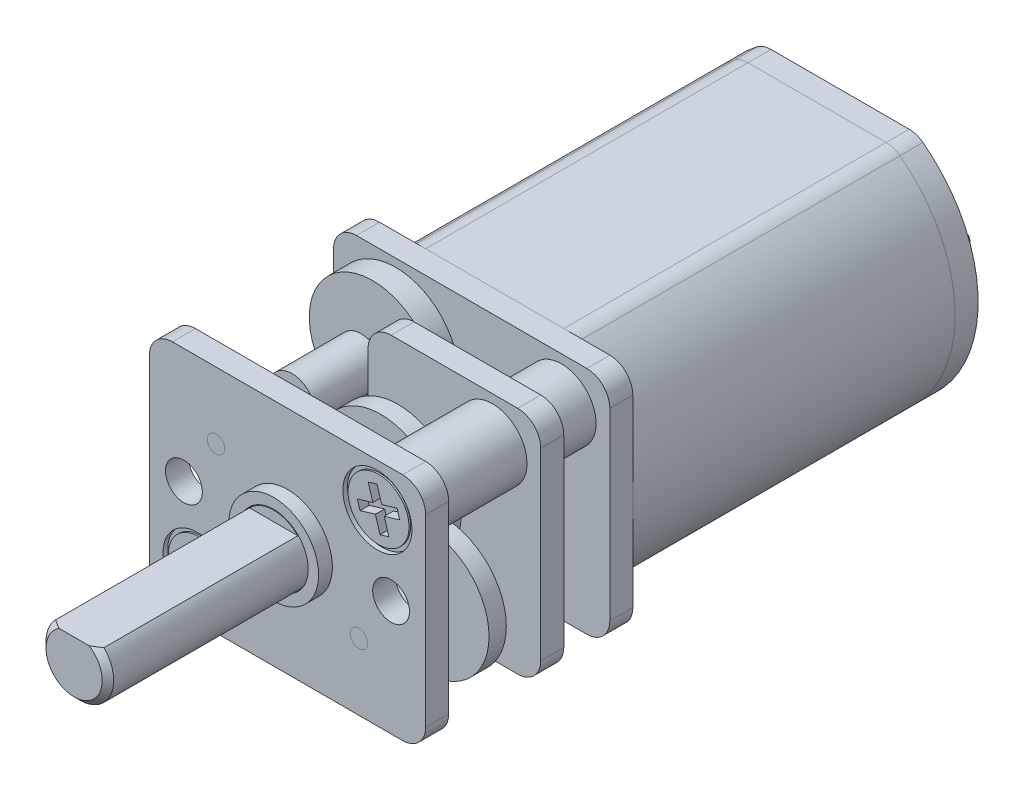
from build123d import *

# Parameters (mm, degrees)
BOSS_EXTRUDE1_DEPTH    = 7.5
FILLET3_R              = 1
BOSS_EXTRUDE2_DEPTH    = 1
BOSS_EXTRUDE3_START    = 9
BOSS_EXTRUDE3_DEPTH    = 1
SKETCH7_R              = 0.5
BOSS_EXTRUDE5_DEPTH    = 8
BOSS_EXTRUDE5_2_DEPTH  = 8
BOSS_EXTRUDE8_START    = 2
BOSS_EXTRUDE8_DEPTH    = 1
CUT_EXTRUDE1_START     = -9
SKETCH5_R              = 0.75
SKETCH5_R_2            = 0.38
CUT_EXTRUDE1_DEPTH     = 9
SKETCH8_R              = 0.5
SKETCH8_R_2            = 0.38
CUT_EXTRUDE2_DEPTH     = 1
BOSS_EXTRUDE6_START    = 0.2
SKETCH9_R              = 2.75
SKETCH9_R_2            = 0.5
BOSS_EXTRUDE6_DEPTH    = 1
BOSS_EXTRUDE16_START   = 0.1
SKETCH9_3_R            = 1
SKETCH9_3_R_2          = 0.75
BOSS_EXTRUDE16_DEPTH   = 1.3
SKETCH6_R              = 1.95
SKETCH6_R_2            = 0.75
BOSS_EXTRUDE4_DEPTH    = 0.6
BOSS_EXTRUDE7_START    = 0.5
SKETCH10_R             = 1
SKETCH10_R_2           = 0.5
BOSS_EXTRUDE7_DEPTH    = 3
SKETCH12_R             = 1.5
SKETCH12_R_2           = 0.75
BOSS_EXTRUDE9_DEPTH    = 2
BOSS_EXTRUDE9_2_DEPTH  = 2
BOSS_EXTRUDE10_START   = 3
SKETCH12_2_R           = 1.5
SKETCH12_2_R_2         = 0.75
BOSS_EXTRUDE10_DEPTH   = 4
BOSS_EXTRUDE10_2_DEPTH = 4
SKETCH13_R             = 1.5
CUT_EXTRUDE3_DEPTH     = 7.2
SKETCH14_R             = 1.5
CUT_EXTRUDE4_DEPTH     = 0.2
CHAMFER1_SIZE          = 0.5
BOSS_EXTRUDE11_START   = 0.2
SKETCH15_R             = 2.75
BOSS_EXTRUDE11_DEPTH   = 0.75
BOSS_EXTRUDE12_START   = 0.2
SKETCH16_R             = 1
BOSS_EXTRUDE12_DEPTH   = 1.15
BOSS_EXTRUDE13_START   = 0.4
SKETCH17_R             = 2.75
BOSS_EXTRUDE13_DEPTH   = 0.75
BOSS_EXTRUDE14_START   = 0.2
SKETCH18_R             = 1
BOSS_EXTRUDE14_DEPTH   = 1.5
SKETCH19_R             = 0.5
CUT_EXTRUDE5_DEPTH     = 25.100622399
SKETCH20_R             = 2.75
BOSS_EXTRUDE15_DEPTH   = 1
CUT_EXTRUDE6_START     = -22.8
SKETCH21_R             = 0.5
CUT_EXTRUDE6_DEPTH     = 24.6
CHAMFER2_SIZE          = 0.25
CUT_EXTRUDE7_DEPTH     = 8.67
SKETCH24_R             = 0.8
CUT_EXTRUDE8_DEPTH     = 1
CUT_EXTRUDE9_START     = -1
CUT_EXTRUDE9_DEPTH     = 1
BOSS_EXTRUDE17_DEPTH   = 1
SKETCH27_R             = 2.5
BOSS_EXTRUDE18_DEPTH   = 1.5
SKETCH28_W             = 0.3
SKETCH28_H             = 1.5
BOSS_EXTRUDE19_DEPTH   = 2
BOSS_EXTRUDE19_2_DEPTH = 2
FILLET1_R              = 0.7
FILLET2_R              = 0.7
CUT_EXTRUDE10_START    = 16.05
CUT_EXTRUDE10_2_DEPTH  = 0.4
CUT_EXTRUDE10_4_DEPTH  = 0.4


with BuildPart() as part:
    # Sketch1 → Boss-Extrude1 (new, symmetric)
    with BuildSketch(Plane.XY):
        with BuildLine():
            Line((3.31662479, 5), (-3.31662479, 5))
            ThreePointArc((-3.31662479, 5), (-6, 0), (-3.31662479, -5))
            Line((-3.31662479, -5), (3.31662479, -5))
            ThreePointArc((3.31662479, -5), (6, 0), (3.31662479, 5))
        make_face()
    extrude(amount=BOSS_EXTRUDE1_DEPTH, both=True)

    # Fillet3
    fillet3_edges = [part.edges().sort_by_distance(p)[0] for p in [
        (3.31662479, -5, 0),
        (-3.31662479, -5, 0),
        (-3.31662479, 5, 0),
        (3.31662479, 5, 0),
    ]]
    fillet(fillet3_edges, radius=FILLET3_R)

    # Sketch25 → Cut-Extrude9 (cut)
    with BuildSketch(Plane(origin=(0, 0, -7.5), x_dir=(-1, 0, 0), z_dir=(0, 0, -1)).offset(CUT_EXTRUDE9_START)):
        with BuildLine():
            Line((-3, -5), (3, -5))
            ThreePointArc((3, -5), (3.316227766, -4.948683298), (3.6, -4.8))
            ThreePointArc((3.6, -4.8), (6, 0), (3.6, 4.8))
            ThreePointArc((3.6, 4.8), (3.316227766, 4.948683298), (3, 5))
            Line((3, 5), (-3, 5))
            ThreePointArc((-3, 5), (-3.316227766, 4.948683298), (-3.6, 4.8))
            ThreePointArc((-3.6, 4.8), (-6, 0), (-3.6, -4.8))
            ThreePointArc((-3.6, -4.8), (-3.316227766, -4.948683298), (-3, -5))
        make_face()
    extrude(amount=CUT_EXTRUDE9_DEPTH, mode=Mode.SUBTRACT)


with BuildPart() as body_2:
    # Sketch2 → Boss-Extrude2 (new body)
    with BuildSketch(Plane.XY.offset(7.5)):
        with BuildLine():
            Line((-5, -5), (5, -5))
            ThreePointArc((5, -5), (5.707106781, -4.707106781), (6, -4))
            Line((6, -4), (6, 4))
            ThreePointArc((6, 4), (5.707106781, 4.707106781), (5, 5))
            Line((5, 5), (-5, 5))
            ThreePointArc((-5, 5), (-5.707106781, 4.707106781), (-6, 4))
            Line((-6, 4), (-6, -4))
            ThreePointArc((-6, -4), (-5.707106781, -4.707106781), (-5, -5))
        make_face()
    extrude(amount=BOSS_EXTRUDE2_DEPTH)


with BuildPart() as body_3:
    # Sketch2<2> → Boss-Extrude3 (new body)
    with BuildSketch(Plane.XY.offset(7.5).offset(BOSS_EXTRUDE3_START)):
        with BuildLine():
            Line((-5, -5), (5, -5))
            ThreePointArc((5, -5), (5.707106781, -4.707106781), (6, -4))
            Line((6, -4), (6, 4))
            ThreePointArc((6, 4), (5.707106781, 4.707106781), (5, 5))
            Line((5, 5), (-5, 5))
            ThreePointArc((-5, 5), (-5.707106781, 4.707106781), (-6, 4))
            Line((-6, 4), (-6, -4))
            ThreePointArc((-6, -4), (-5.707106781, -4.707106781), (-5, -5))
        make_face()
    extrude(amount=-BOSS_EXTRUDE3_DEPTH)


with BuildPart() as body_4:
    # Sketch7 → Boss-Extrude5 (new body)
    with BuildSketch(Plane.XY.offset(8.5)):
        with Locations(Location((-3.104083332, 2.104083332, 0), (0, 0, 180))):
            Circle(SKETCH7_R)
    extrude(amount=BOSS_EXTRUDE5_DEPTH)


with BuildPart() as body_5:
    # Sketch7 → Boss-Extrude5 2 (new body)
    with BuildSketch(Plane.XY.offset(8.5)):
        with Locations(Location((3.104083332, -2.104083332, 0), (0, 0, 180))):
            Circle(SKETCH7_R)
    extrude(amount=BOSS_EXTRUDE5_2_DEPTH)


with BuildPart() as body_6:
    # Sketch11 → Boss-Extrude8 (new body)
    with BuildSketch(Plane.XY.offset(8.5).offset(BOSS_EXTRUDE8_START)):
        with BuildLine():
            Line((-5, -1.25), (-2.5, -1.25))
            ThreePointArc((-2.5, -1.25), (-1.792893219, -0.957106781), (-1.5, -0.25))
            Line((-1.5, -0.25), (-1.5, 4))
            ThreePointArc((-1.5, 4), (-1.207106781, 4.707106781), (-0.5, 5))
            Line((-0.5, 5), (5, 5))
            ThreePointArc((5, 5), (5.707106781, 4.707106781), (6, 4))
            Line((6, 4), (6, -4))
            ThreePointArc((6, -4), (5.707106781, -4.707106781), (5, -5))
            Line((5, -5), (-5, -5))
            ThreePointArc((-5, -5), (-5.707106781, -4.707106781), (-6, -4))
            Line((-6, -4), (-6, -2.25))
            ThreePointArc((-6, -2.25), (-5.707106781, -1.542893219), (-5, -1.25))
        make_face()
    extrude(amount=BOSS_EXTRUDE8_DEPTH)


with BuildPart() as cut_extrude1_tool:
    # Sketch5 → Cut-Extrude1 (new body)
    with BuildSketch(Plane.XY.offset(16.5).offset(CUT_EXTRUDE1_START)):
        Circle(SKETCH5_R)
        with Locations((-3.104083332, 2.104083332)):
            Circle(SKETCH5_R_2)
        with Locations((3.104083332, -2.104083332)):
            Circle(SKETCH5_R_2)
        with Locations((3.904344047, 3.123475238)):
            Circle(SKETCH5_R)
        with Locations((-3.904344047, -3.123475238)):
            Circle(SKETCH5_R)
    extrude(amount=CUT_EXTRUDE1_DEPTH)


with BuildPart() as body_2_1:
    add(body_2.part)

    # Cut-Extrude1: cut by cut_extrude1_tool
    add(cut_extrude1_tool.part, mode=Mode.SUBTRACT)


with BuildPart() as body_3_1:
    add(body_3.part)

    # Cut-Extrude1: cut by cut_extrude1_tool
    add(cut_extrude1_tool.part, mode=Mode.SUBTRACT)

    # Sketch6 → Boss-Extrude4 (add)
    with BuildSketch(Plane.XY.offset(16.5)):
        with Locations(Location((0, 0, 0), (0, 0, 180))):
            Circle(SKETCH6_R)
        Circle(SKETCH6_R_2, mode=Mode.SUBTRACT)
    extrude(amount=BOSS_EXTRUDE4_DEPTH)

    # Sketch13 → Cut-Extrude3 (cut)
    with BuildSketch(Plane.XY.offset(17.1)):
        Circle(SKETCH13_R)
    extrude(amount=-CUT_EXTRUDE3_DEPTH, mode=Mode.SUBTRACT)

    # Sketch14 → Cut-Extrude4 (cut)
    with BuildSketch(Plane.XY.offset(16.5)):
        with Locations(Location((3.904344047, 3.123475238, 0), (0, 0, 180))):
            Circle(SKETCH14_R)
        with Locations(Location((-3.904344047, -3.123475238, 0), (0, 0, 180))):
            Circle(SKETCH14_R)
    extrude(amount=-CUT_EXTRUDE4_DEPTH, mode=Mode.SUBTRACT)

    # Chamfer1
    chamfer1_edges = [body_3_1.edges().sort_by_distance(p)[0] for p in [
        (3.154344047, 3.123475238, 16.3),
        (-4.654344047, -3.123475238, 16.3),
    ]]
    chamfer(chamfer1_edges, length=CHAMFER1_SIZE)

    # Sketch24 → Cut-Extrude8 (cut)
    with BuildSketch(Plane.XY.offset(16.5)):
        with Locations((4.5, 0)):
            Circle(SKETCH24_R)
        with Locations((-4.5, 0)):
            Circle(SKETCH24_R)
    extrude(amount=-CUT_EXTRUDE8_DEPTH, mode=Mode.SUBTRACT)


with BuildPart() as body_6_1:
    add(body_6.part)

    # Cut-Extrude1: cut by cut_extrude1_tool
    add(cut_extrude1_tool.part, mode=Mode.SUBTRACT)


with BuildPart() as cut_extrude2_tool:
    # Sketch8 → Cut-Extrude2 (new body)
    # profile 1 of 2: a face of its own
    with BuildSketch(Plane.XY.offset(16.5)):
        with Locations((-3.104083332, 2.104083332)):
            Circle(SKETCH8_R)
        with Locations((-3.104083332, 2.104083332)):
            Circle(SKETCH8_R_2, mode=Mode.SUBTRACT)
    # profile 2 of 2: a face of its own
    with BuildSketch(Plane.XY.offset(16.5)):
        with Locations((3.104083332, -2.104083332)):
            Circle(SKETCH8_R)
        with Locations((3.104083332, -2.104083332)):
            Circle(SKETCH8_R_2, mode=Mode.SUBTRACT)
    extrude(amount=-CUT_EXTRUDE2_DEPTH)


with BuildPart() as body_4_1:
    add(body_4.part)

    # Cut-Extrude2: cut by cut_extrude2_tool
    add(cut_extrude2_tool.part, mode=Mode.SUBTRACT)


with BuildPart() as body_5_1:
    add(body_5.part)

    # Cut-Extrude2: cut by cut_extrude2_tool
    add(cut_extrude2_tool.part, mode=Mode.SUBTRACT)


with BuildPart() as body_7:
    # Sketch9 → Boss-Extrude6 (new body)
    with BuildSketch(Plane.XY.offset(8.5).offset(BOSS_EXTRUDE6_START)):
        with Locations((-3.104083332, 2.104083332)):
            Circle(SKETCH9_R)
        with Locations((-3.104083332, 2.104083332)):
            Circle(SKETCH9_R_2, mode=Mode.SUBTRACT)
    extrude(amount=BOSS_EXTRUDE6_DEPTH)


with BuildPart() as body_8:
    # Sketch9<3> → Boss-Extrude16 (new body)
    # profile 1 of 2: a face of its own
    with BuildSketch(Plane.XY.offset(8.5).offset(BOSS_EXTRUDE16_START)):
        Circle(SKETCH9_3_R)
        Circle(SKETCH9_3_R_2, mode=Mode.SUBTRACT)
    # profile 2 of 2: a face of its own
    with BuildSketch(Plane.XY.offset(8.5).offset(BOSS_EXTRUDE16_START)):
        Circle(SKETCH9_3_R_2)
    extrude(amount=BOSS_EXTRUDE16_DEPTH)


with BuildPart() as body_9:
    # Sketch10 → Boss-Extrude7 (new body)
    with BuildSketch(Plane.XY.offset(9.7).offset(BOSS_EXTRUDE7_START)):
        with Locations((-3.104083332, 2.104083332)):
            Circle(SKETCH10_R)
        with Locations((-3.104083332, 2.104083332)):
            Circle(SKETCH10_R_2, mode=Mode.SUBTRACT)
    extrude(amount=BOSS_EXTRUDE7_DEPTH)


with BuildPart() as body_10:
    # Sketch12 → Boss-Extrude9 (new body)
    with BuildSketch(Plane.XY.offset(8.5)):
        with Locations((-3.904344047, -3.123475238)):
            Circle(SKETCH12_R)
        with Locations((-3.904344047, -3.123475238)):
            Circle(SKETCH12_R_2, mode=Mode.SUBTRACT)
    extrude(amount=BOSS_EXTRUDE9_DEPTH)


with BuildPart() as body_11:
    # Sketch12 → Boss-Extrude9 2 (new body)
    with BuildSketch(Plane.XY.offset(8.5)):
        with Locations((3.904344047, 3.123475238)):
            Circle(SKETCH12_R)
        with Locations((3.904344047, 3.123475238)):
            Circle(SKETCH12_R_2, mode=Mode.SUBTRACT)
    extrude(amount=BOSS_EXTRUDE9_2_DEPTH)


with BuildPart() as body_12:
    # Sketch12<2> → Boss-Extrude10 (new body)
    with BuildSketch(Plane.XY.offset(8.5).offset(BOSS_EXTRUDE10_START)):
        with Locations(Location((-3.904344047, -3.123475238, 0), (0, 0, 180))):
            Circle(SKETCH12_2_R)
        with Locations(Location((-3.904344047, -3.123475238, 0), (0, 0, 180))):
            Circle(SKETCH12_2_R_2, mode=Mode.SUBTRACT)
    extrude(amount=BOSS_EXTRUDE10_DEPTH)


with BuildPart() as body_13:
    # Sketch12<2> → Boss-Extrude10 2 (new body)
    with BuildSketch(Plane.XY.offset(8.5).offset(BOSS_EXTRUDE10_START)):
        with Locations(Location((3.904344047, 3.123475238, 0), (0, 0, 180))):
            Circle(SKETCH12_2_R)
        with Locations(Location((3.904344047, 3.123475238, 0), (0, 0, 180))):
            Circle(SKETCH12_2_R_2, mode=Mode.SUBTRACT)
    extrude(amount=BOSS_EXTRUDE10_2_DEPTH)


with BuildPart() as body_14:
    # Sketch15 → Boss-Extrude11 (new body)
    with BuildSketch(Plane.XY.offset(11.5).offset(BOSS_EXTRUDE11_START)):
        Circle(SKETCH15_R)
    extrude(amount=BOSS_EXTRUDE11_DEPTH)


with BuildPart() as body_15:
    # Sketch16 → Boss-Extrude12 (new body)
    with BuildSketch(Plane.XY.offset(12.45).offset(BOSS_EXTRUDE12_START)):
        Circle(SKETCH16_R)
    extrude(amount=BOSS_EXTRUDE12_DEPTH)


with BuildPart() as body_16:
    # Sketch17 → Boss-Extrude13 (new body)
    with BuildSketch(Plane.XY.offset(12.45).offset(BOSS_EXTRUDE13_START)):
        with Locations((3.104083332, -2.104083332)):
            Circle(SKETCH17_R)
    extrude(amount=BOSS_EXTRUDE13_DEPTH)


with BuildPart() as body_17:
    # Sketch18 → Boss-Extrude14 (new body)
    with BuildSketch(Plane.XY.offset(13.6).offset(BOSS_EXTRUDE14_START)):
        with Locations((3.104083332, -2.104083332)):
            Circle(SKETCH18_R)
    extrude(amount=BOSS_EXTRUDE14_DEPTH)


with BuildPart() as cut_extrude5_tool:
    # Sketch19 → Cut-Extrude5 (new, through all)
    with BuildSketch(Plane.XY.offset(15.3)):
        with Locations((3.104083332, -2.104083332)):
            Circle(SKETCH19_R)
    extrude(amount=-CUT_EXTRUDE5_DEPTH)


with BuildPart() as body_17_1:
    add(body_17.part)

    # Cut-Extrude5: cut by cut_extrude5_tool
    add(cut_extrude5_tool.part, mode=Mode.SUBTRACT)


with BuildPart() as body_16_1:
    add(body_16.part)

    # Cut-Extrude5: cut by cut_extrude5_tool
    add(cut_extrude5_tool.part, mode=Mode.SUBTRACT)


with BuildPart() as body_6_2:
    add(body_6_1.part)

    # Cut-Extrude5: cut by cut_extrude5_tool
    add(cut_extrude5_tool.part, mode=Mode.SUBTRACT)


with BuildPart() as body_18:
    # Sketch20 → Boss-Extrude15 (new body)
    with BuildSketch(Plane.XY.offset(15.3)):
        Circle(SKETCH20_R)
    extrude(amount=-BOSS_EXTRUDE15_DEPTH)


with BuildPart() as cut_extrude6_tool:
    # Sketch21 → Cut-Extrude6 (new body)
    with BuildSketch(Plane.XY.offset(15.3).offset(CUT_EXTRUDE6_START)):
        Circle(SKETCH21_R)
    extrude(amount=CUT_EXTRUDE6_DEPTH)


with BuildPart() as body_14_1:
    add(body_14.part)

    # Cut-Extrude6: cut by cut_extrude6_tool
    add(cut_extrude6_tool.part, mode=Mode.SUBTRACT)


with BuildPart() as body_15_1:
    add(body_15.part)

    # Cut-Extrude6: cut by cut_extrude6_tool
    add(cut_extrude6_tool.part, mode=Mode.SUBTRACT)


with BuildPart() as body_18_1:
    add(body_18.part)

    # Cut-Extrude6: cut by cut_extrude6_tool
    add(cut_extrude6_tool.part, mode=Mode.SUBTRACT)


with BuildPart() as body_8_1:
    add(body_8.part)

    # Cut-Extrude6: cut by cut_extrude6_tool
    add(cut_extrude6_tool.part, mode=Mode.SUBTRACT)


with BuildPart() as body_19:
    # Sketch22 → Revolve1 (revolve)
    with BuildSketch(Plane(origin=(0, 0, 0), x_dir=(1, 0, 0), z_dir=(0, 1, 0))):
        Polygon((-0.5, -7.5), (-0.5, -15.3), (-1.47, -15.3), (-1.47, -25.77), (0, -25.77), (0, -7.5), align=None)
    revolve(axis=Axis((0, 0, 0), (0, 0, 1)))

    # Chamfer2
    chamfer2_edges = [body_19.edges().sort_by_distance(p)[0] for p in [
        (1.47, 0, 25.77),
    ]]
    chamfer(chamfer2_edges, length=CHAMFER2_SIZE)

    # Sketch23 → Cut-Extrude7 (cut)
    with BuildSketch(Plane.XY.offset(25.77)):
        with BuildLine():
            Line((1.048808848, 1.03), (-1.048808848, 1.03))
            ThreePointArc((-1.048808848, 1.03), (0, 1.47), (1.048808848, 1.03))
        make_face()
    extrude(amount=-CUT_EXTRUDE7_DEPTH, mode=Mode.SUBTRACT)


with BuildPart() as body_20:
    # Sketch26 → Boss-Extrude17 (new body)
    with BuildSketch(Plane(origin=(0, 0, -6.5), x_dir=(-1, 0, 0), z_dir=(0, 0, -1))):
        with BuildLine():
            Line((-3, -5), (3, -5))
            ThreePointArc((3, -5), (3.316227766, -4.948683298), (3.6, -4.8))
            ThreePointArc((3.6, -4.8), (6, 0), (3.6, 4.8))
            ThreePointArc((3.6, 4.8), (3.316227766, 4.948683298), (3, 5))
            Line((3, 5), (-3, 5))
            ThreePointArc((-3, 5), (-3.316227766, 4.948683298), (-3.6, 4.8))
            ThreePointArc((-3.6, 4.8), (-6, 0), (-3.6, -4.8))
            ThreePointArc((-3.6, -4.8), (-3.316227766, -4.948683298), (-3, -5))
        make_face()
    extrude(amount=BOSS_EXTRUDE17_DEPTH)

    # Sketch27 → Boss-Extrude18 (add)
    with BuildSketch(Plane(origin=(0, 0, -7.5), x_dir=(-1, 0, 0), z_dir=(0, 0, -1))):
        Circle(SKETCH27_R)
    extrude(amount=BOSS_EXTRUDE18_DEPTH)


with BuildPart() as body_21:
    # Sketch28 → Boss-Extrude19 (new body)
    with BuildSketch(Plane(origin=(0, 0, -7.5), x_dir=(-1, 0, 0), z_dir=(0, 0, -1))):
        with Locations((3.5, 0)):
            Rectangle(SKETCH28_W, SKETCH28_H)
    extrude(amount=BOSS_EXTRUDE19_DEPTH)

    # Fillet1
    fillet1_edges = [body_21.edges().sort_by_distance(p)[0] for p in [
        (-3.5, -0.75, -9.5),
        (-3.5, 0.75, -9.5),
    ]]
    fillet(fillet1_edges, radius=FILLET1_R)


with BuildPart() as body_22:
    # Sketch28 → Boss-Extrude19 2 (new body)
    with BuildSketch(Plane(origin=(0, 0, -7.5), x_dir=(-1, 0, 0), z_dir=(0, 0, -1))):
        with Locations((-3.5, 0)):
            Rectangle(SKETCH28_W, SKETCH28_H)
    extrude(amount=BOSS_EXTRUDE19_2_DEPTH)

    # Fillet2
    fillet2_edges = [body_22.edges().sort_by_distance(p)[0] for p in [
        (3.5, -0.75, -9.5),
        (3.5, 0.75, -9.5),
    ]]
    fillet(fillet2_edges, radius=FILLET2_R)


with BuildPart() as body_23:
    # Cut-Extrude10: read off the stored shape, not the designer's step
    # Cut-Extrude10 outline → Cut-Extrude10 (revolve)
    with BuildSketch(Plane(origin=(-3.904344047, -3.123475238, 0), x_dir=(1, 0, 0), z_dir=(0, -1, 0))):
        Polygon((0.921954446, 16.05), (0, 16.05), (0, 7.5), (0.7, 7.5), (0.7, 15.755), (1.325, 16.38), (1.325, 16.45), (0.921954446, 16.45), align=None)
    revolve(axis=Axis((-3.904344047, -3.123475238, 0), (0, 0, 1)))

    # Cut-Extrude10 2 outline → Cut-Extrude10 2 (add)
    with BuildSketch(Plane.XY.offset(CUT_EXTRUDE10_START)):
        with BuildLine():
            ThreePointArc((-2.991618301, -3.253597153), (-3.064453219, -2.743234002), (-3.399902702, -2.35176355))
            Line((-3.399902702, -2.35176355), (-3.646677303, -3.006822552))
            Line((-3.646677303, -3.006822552), (-2.991618301, -3.253597153))
        make_face()
        with BuildLine():
            Line((-3.774222132, -2.210749492), (-3.399902702, -2.35176355))
            ThreePointArc((-3.399902702, -2.35176355), (-3.579322703, -2.260711582), (-3.774222132, -2.210749492))
        make_face()
        with BuildLine():
            Line((-4.020996733, -2.865808494), (-3.774222132, -2.210749492))
            ThreePointArc((-3.774222132, -2.210749492), (-4.284585282, -2.28358441), (-4.676055735, -2.619033892))
            Line((-4.676055735, -2.619033892), (-4.020996733, -2.865808494))
        make_face()
        with BuildLine():
            Line((-4.817069793, -2.993353322), (-4.676055735, -2.619033892))
            ThreePointArc((-4.676055735, -2.619033892), (-4.767107703, -2.798453893), (-4.817069793, -2.993353322))
        make_face()
        with BuildLine():
            ThreePointArc((-3.132632359, -3.627916583), (-3.041580391, -3.448496582), (-2.991618301, -3.253597153))
            Line((-2.991618301, -3.253597153), (-3.132632359, -3.627916583))
        make_face()
        with BuildLine():
            Line((-4.162010791, -3.240127924), (-4.817069793, -2.993353322))
            ThreePointArc((-4.817069793, -2.993353322), (-4.744234876, -3.503716473), (-4.408785393, -3.895186926))
            Line((-4.408785393, -3.895186926), (-4.162010791, -3.240127924))
        make_face()
        with BuildLine():
            ThreePointArc((-4.034465963, -4.036200984), (-3.524102812, -3.963366066), (-3.132632359, -3.627916583))
            Line((-3.132632359, -3.627916583), (-3.787691361, -3.381141982))
            Line((-3.787691361, -3.381141982), (-4.034465963, -4.036200984))
        make_face()
        with BuildLine():
            Line((-4.034465963, -4.036200984), (-4.408785393, -3.895186926))
            ThreePointArc((-4.408785393, -3.895186926), (-4.229365392, -3.986238894), (-4.034465963, -4.036200984))
        make_face()
    extrude(amount=CUT_EXTRUDE10_2_DEPTH)


with BuildPart() as body_24:
    # Cut-Extrude10 3 outline → Cut-Extrude10 3 (revolve)
    with BuildSketch(Plane(origin=(3.904344047, 3.123475238, 0), x_dir=(1, 0, 0), z_dir=(0, -1, 0))):
        Polygon((1.325, 16.38), (1.325, 16.45), (0.921954446, 16.45), (0.921954446, 16.05), (0, 16.05), (0, 7.5), (0.7, 7.5), (0.7, 15.755), align=None)
    revolve(axis=Axis((3.904344047, 3.123475238, 0), (0, 0, 1)))

    # Cut-Extrude10 4 outline → Cut-Extrude10 4 (add)
    with BuildSketch(Plane.XY.offset(CUT_EXTRUDE10_START)):
        with BuildLine():
            ThreePointArc((4.710216547, 3.571325117), (4.343788015, 3.933962129), (3.83995545, 4.04317851))
            Line((3.83995545, 4.04317851), (4.039159302, 3.372121265))
            Line((4.039159302, 3.372121265), (4.710216547, 3.571325117))
        make_face()
        with BuildLine():
            Line((3.456494168, 3.929347738), (3.83995545, 4.04317851))
            ThreePointArc((3.83995545, 4.04317851), (3.64197708, 4.007309824), (3.456494168, 3.929347738))
        make_face()
        with BuildLine():
            Line((3.65569802, 3.258290493), (3.456494168, 3.929347738))
            ThreePointArc((3.456494168, 3.929347738), (3.093857156, 3.562919206), (2.984640775, 3.059086641))
            Line((2.984640775, 3.059086641), (3.65569802, 3.258290493))
        make_face()
        with BuildLine():
            ThreePointArc((4.824047319, 3.187863835), (4.788178633, 3.385842205), (4.710216547, 3.571325117))
            Line((4.710216547, 3.571325117), (4.824047319, 3.187863835))
        make_face()
        with BuildLine():
            Line((3.098471548, 2.675625358), (2.984640775, 3.059086641))
            ThreePointArc((2.984640775, 3.059086641), (3.020509461, 2.861108271), (3.098471548, 2.675625358))
        make_face()
        with BuildLine():
            ThreePointArc((4.352193927, 2.317602738), (4.714830938, 2.684031271), (4.824047319, 3.187863835))
            Line((4.824047319, 3.187863835), (4.152990075, 2.988659983))
            Line((4.152990075, 2.988659983), (4.352193927, 2.317602738))
        make_face()
        with BuildLine():
            Line((3.769528792, 2.87482921), (3.098471548, 2.675625358))
            ThreePointArc((3.098471548, 2.675625358), (3.46490008, 2.312988347), (3.968732644, 2.203771966))
            Line((3.968732644, 2.203771966), (3.769528792, 2.87482921))
        make_face()
        with BuildLine():
            Line((4.352193927, 2.317602738), (3.968732644, 2.203771966))
            ThreePointArc((3.968732644, 2.203771966), (4.166711014, 2.239640652), (4.352193927, 2.317602738))
        make_face()
    extrude(amount=CUT_EXTRUDE10_4_DEPTH)


solid = Compound([part.part, body_2_1.part, body_3_1.part, body_4_1.part, body_5_1.part, body_7.part, body_9.part, body_10.part, body_11.part, body_12.part, body_13.part, body_17_1.part, body_16_1.part, body_6_2.part, body_14_1.part, body_15_1.part, body_18_1.part, body_8_1.part, body_19.part, body_20.part, body_21.part, body_22.part, body_23.part, body_24.part])
